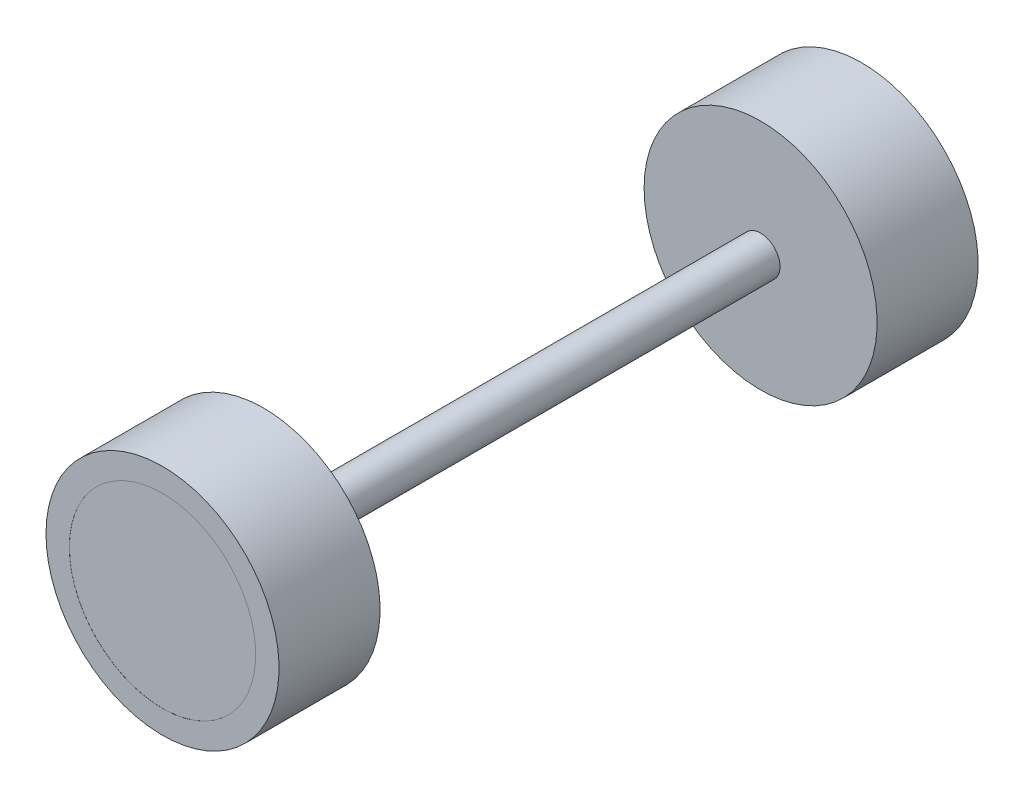
from build123d import *

# Parameters (mm, degrees)
CROQUIS1_R              = 15
SALIENTE_EXTRUIR1_DEPTH = 13
CROQUIS2_R              = 2.5
SALIENTE_EXTRUIR2_DEPTH = 32
SALIENTE_EXTRUIR3_START = 0.01
CROQUIS3_R              = 15
CROQUIS3_R_2            = 12
SALIENTE_EXTRUIR3_DEPTH = 0.01
CROQUIS4_R              = 15
CROQUIS4_R_2            = 12
SALIENTE_EXTRUIR4_DEPTH = 0.01


with BuildPart() as part:
    # Croquis1 → Saliente-Extruir1 (new body)
    with BuildSketch(Plane.XY):
        Circle(CROQUIS1_R)
    saliente_extruir1 = extrude(amount=SALIENTE_EXTRUIR1_DEPTH)

    # Croquis2 → Saliente-Extruir2 (add)
    with BuildSketch(Plane.XY.offset(13)):
        Circle(CROQUIS2_R)
    saliente_extruir2 = extrude(amount=SALIENTE_EXTRUIR2_DEPTH)


with BuildPart() as body_2:
    # Partir1: the piece on the far side of the plane
    add(part.part)
    split(bisect_by=Plane.XY.offset(13), keep=Keep.BOTTOM)

    # Croquis4 → Saliente-Extruir4 (add)
    with BuildSketch(Plane(origin=(0, 0, 0), x_dir=(-1, 0, 0), z_dir=(0, 0, -1))):
        Circle(CROQUIS4_R)
        Circle(CROQUIS4_R_2, mode=Mode.SUBTRACT)
    extrude(amount=SALIENTE_EXTRUIR4_DEPTH)


with BuildPart() as part_1:
    add(part.part)

    # Partir1
    split(bisect_by=Plane.XY.offset(13), keep=Keep.TOP)

    # Simetría1: Saliente-Extruir1, Saliente-Extruir2 across plane
    add(saliente_extruir1.mirror(Plane.XY.offset(45)))
    add(saliente_extruir2.mirror(Plane.XY.offset(45)))

    # Croquis3 → Saliente-Extruir3 (add)
    with BuildSketch(Plane.XY.offset(90).offset(SALIENTE_EXTRUIR3_START)):
        Circle(CROQUIS3_R)
        Circle(CROQUIS3_R_2, mode=Mode.SUBTRACT)
    extrude(amount=-SALIENTE_EXTRUIR3_DEPTH)


solid = Compound([body_2.part, part_1.part])
